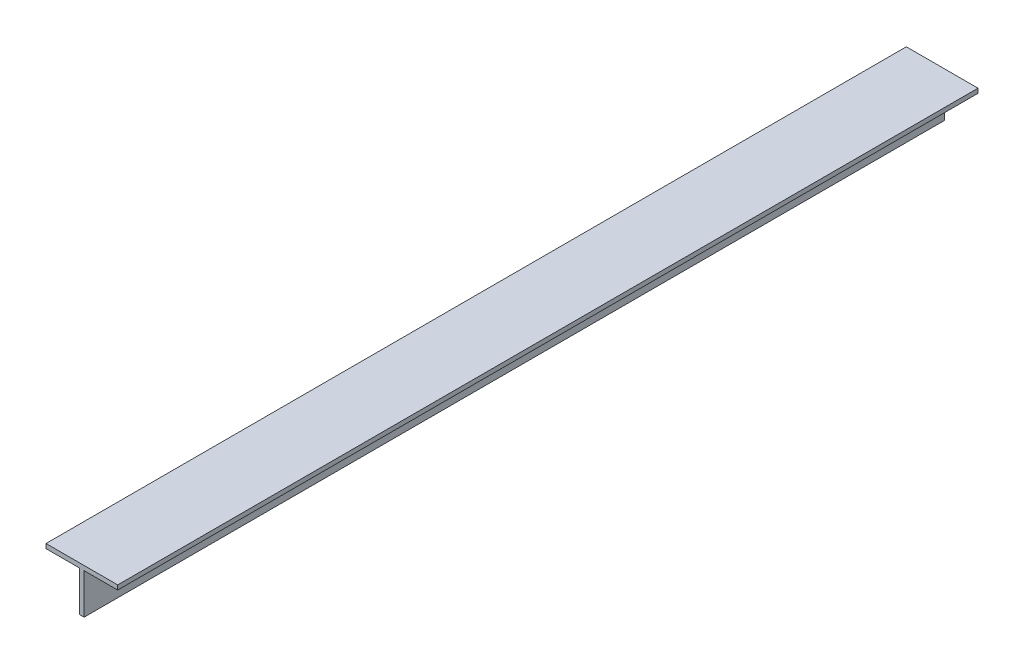
from build123d import *

# Parameters (mm, degrees)
BOSS_EXTRUDE1_DEPTH = 304.8
SKETCH2_R           = 3.5
CUT_EXTRUDE1_DEPTH  = 308.635218491


with BuildPart() as part:
    # Sketch1 → Boss-Extrude1 (new, symmetric)
    with BuildSketch(Plane.XY):
        Polygon((-25.4, 31.75), (-25.4, 28.575), (-1.5875, 28.575), (-1.5875, 0), (1.5875, 0), (1.5875, 28.575), (25.4, 28.575), (25.4, 31.75), align=None)
    extrude(amount=BOSS_EXTRUDE1_DEPTH, both=True)

    # Sketch2 → Cut-Extrude1 (cut, through all)
    with BuildSketch(Plane(origin=(1.5875, 0, 0), x_dir=(0, 0, -1), z_dir=(1, 0, 0))):
        with Locations((-228.6, 15.875)):
            Circle(SKETCH2_R)
        with Locations((228.6, 15.875)):
            Circle(SKETCH2_R)
    extrude(amount=-CUT_EXTRUDE1_DEPTH, mode=Mode.SUBTRACT)


solid = part.part
